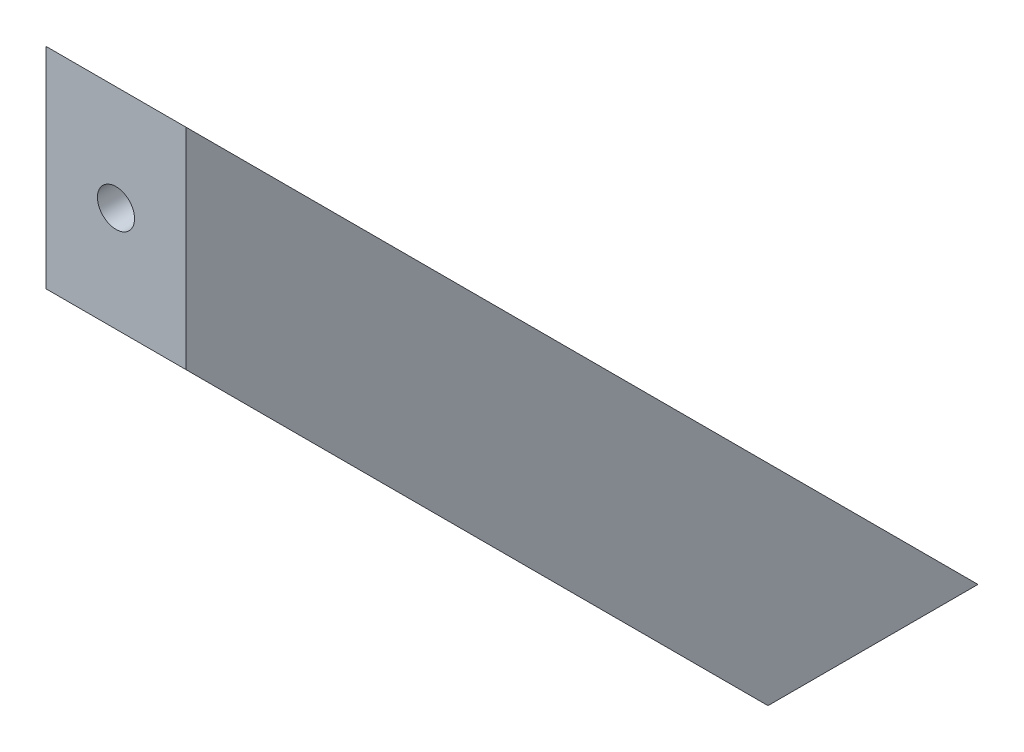
from build123d import *

# Parameters (mm, degrees)
BOSS_EXTRUDE1_DEPTH = 20
SKETCH3_R           = 2.65
CUT_EXTRUDE1_DEPTH  = 142.81598958
SKETCH4_R           = 2.65
CUT_EXTRUDE2_DEPTH  = 162.245154966
SKETCH5_R           = 5.5
CUT_EXTRUDE3_DEPTH  = 158.777150279
SKETCH6_R           = 5.5
CUT_EXTRUDE4_DEPTH  = 138.860088679


with BuildPart() as part:
    # Sketch2 → Boss-Extrude1 (new body)
    with BuildSketch(Plane(origin=(0, 0, 0), x_dir=(0, 0, -1), z_dir=(1, 0, 0))):
        Polygon((0, 0), (-83.13708499, 83.13708499), (-83.13708499, 113.13708499), (30, 0), align=None)
    extrude(amount=BOSS_EXTRUDE1_DEPTH)

    # Sketch3 → Cut-Extrude1 (cut, through all)
    with BuildSketch(Plane.XZ):
        with Locations((10, -15)):
            Circle(SKETCH3_R)
    extrude(amount=-CUT_EXTRUDE1_DEPTH, mode=Mode.SUBTRACT)

    # Sketch4 → Cut-Extrude2 (cut, through all)
    with BuildSketch(Plane.XY.offset(83.13708499)):
        with Locations((10, 98.13708499)):
            Circle(SKETCH4_R)
    extrude(amount=-CUT_EXTRUDE2_DEPTH, mode=Mode.SUBTRACT)

    # Sketch5 → Cut-Extrude3 (cut, through all)
    with BuildSketch(Plane.XY.offset(78.13708499)):
        with Locations((10, 98.13708499)):
            Circle(SKETCH5_R)
    extrude(amount=-CUT_EXTRUDE3_DEPTH, mode=Mode.SUBTRACT)

    # Sketch6 → Cut-Extrude4 (cut, through all)
    with BuildSketch(Plane(origin=(0, 5, 0), x_dir=(-1, 0, 0), z_dir=(0, -1, 0))):
        with Locations((-10, 15)):
            Circle(SKETCH6_R)
    extrude(amount=-CUT_EXTRUDE4_DEPTH, mode=Mode.SUBTRACT)


solid = part.part
